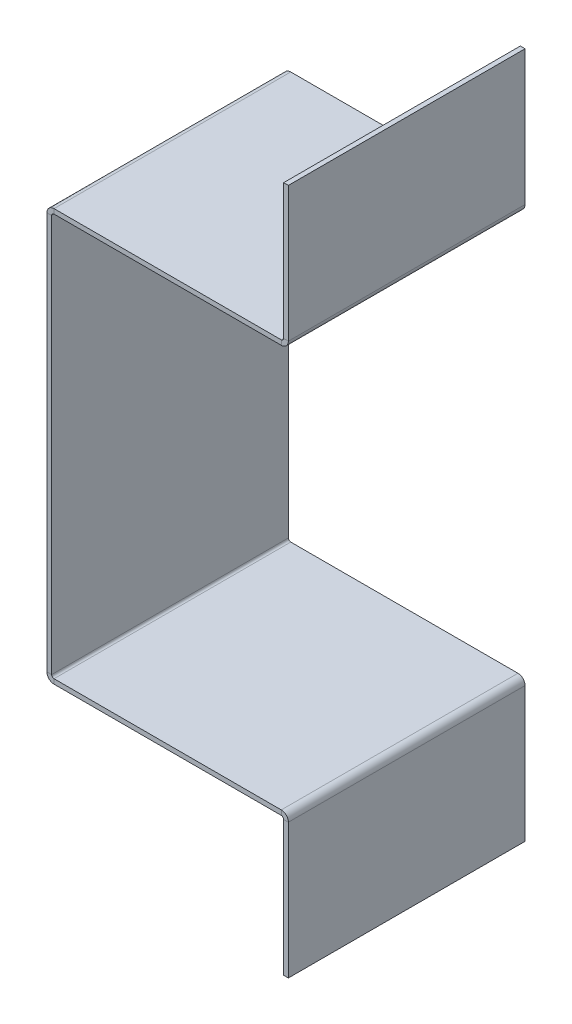
from build123d import *

# Parameters (mm, degrees)
EXTRU_MINCE1_DEPTH        = 100
CONVERTIR_VOLUME1_DEPTH   = 100
CONVERTIR_VOLUME1_2_DEPTH = 100


# Read off the part's stored shape, not the designer's step: Convertir-Volume1
with BuildPart() as part:
    # Esquisse1 → Extru.-Mince1 (new body)
    with BuildSketch(Plane.XY):
        Polygon((-133.505441468, 147.472825463), (-133.505441468, 87.472825463), (-233.505441468, 87.472825463), (-233.505441468, -82.527174537), (-133.505441468, -82.527174537), (-133.505441468, -142.527174537), (-123.505441468, -142.527174537), (-123.505441468, -72.527174537), (-223.505441468, -72.527174537), (-223.505441468, 77.472825463), (-123.505441468, 77.472825463), (-123.505441468, 147.472825463), align=None)
    extrude(amount=EXTRU_MINCE1_DEPTH)

    # Convertir-Volume1 outline → Convertir-Volume1 (cut)
    with BuildSketch(Plane.XY):
        with BuildLine():
            Line((-123.505441468, 147.472825463), (-133.505441468, 147.472825463))
            Line((-133.505441468, 147.472825463), (-133.505441468, 87.472825463))
            Line((-133.505441468, 87.472825463), (-232.505441468, 87.472825463))
            ThreePointArc((-232.505441468, 87.472825463), (-233.212548249, 87.179932244), (-233.505441468, 86.472825463))
            Line((-233.505441468, 86.472825463), (-233.505441468, -81.527174537))
            ThreePointArc((-233.505441468, -81.527174537), (-233.212548249, -82.234281318), (-232.505441468, -82.527174537))
            Line((-232.505441468, -82.527174537), (-133.505441468, -82.527174537))
            Line((-133.505441468, -82.527174537), (-133.505441468, -142.527174537))
            Line((-133.505441468, -142.527174537), (-123.505441468, -142.527174537))
            Line((-123.505441468, -142.527174537), (-123.505441468, -72.527174537))
            Line((-123.505441468, -72.527174537), (-223.505441468, -72.527174537))
            Line((-223.505441468, -72.527174537), (-223.505441468, 77.472825463))
            Line((-223.505441468, 77.472825463), (-123.505441468, 77.472825463))
            Line((-123.505441468, 77.472825463), (-123.505441468, 147.472825463))
        make_face()
    extrude(amount=CONVERTIR_VOLUME1_DEPTH, mode=Mode.SUBTRACT)

    # Convertir-Volume1 2 outline → Convertir-Volume1 2 (add)
    with BuildSketch(Plane.XY):
        with BuildLine():
            Line((-133.505441468, 147.472825463), (-135.505441468, 147.472825463))
            Line((-135.505441468, 147.472825463), (-135.505441468, 90.472825463))
            ThreePointArc((-135.505441468, 90.472825463), (-135.798334686, 89.765718682), (-136.505441468, 89.472825463))
            Line((-136.505441468, 89.472825463), (-232.505441468, 89.472825463))
            ThreePointArc((-232.505441468, 89.472825463), (-234.626761811, 88.594145807), (-235.505441468, 86.472825463))
            Line((-235.505441468, 86.472825463), (-235.505441468, -81.527174537))
            ThreePointArc((-235.505441468, -81.527174537), (-234.626761811, -83.64849488), (-232.505441468, -84.527174537))
            Line((-232.505441468, -84.527174537), (-136.505441468, -84.527174537))
            ThreePointArc((-136.505441468, -84.527174537), (-135.798334686, -84.820067756), (-135.505441468, -85.527174537))
            Line((-135.505441468, -85.527174537), (-135.505441468, -142.527174537))
            Line((-135.505441468, -142.527174537), (-133.505441468, -142.527174537))
            Line((-133.505441468, -142.527174537), (-133.505441468, -85.527174537))
            ThreePointArc((-133.505441468, -85.527174537), (-134.384121124, -83.405854193), (-136.505441468, -82.527174537))
            Line((-136.505441468, -82.527174537), (-233.505441468, -82.527174537))
            Line((-233.505441468, -82.527174537), (-233.505441468, 87.472825463))
            Line((-233.505441468, 87.472825463), (-136.505441468, 87.472825463))
            ThreePointArc((-136.505441468, 87.472825463), (-134.384121124, 88.351505119), (-133.505441468, 90.472825463))
            Line((-133.505441468, 90.472825463), (-133.505441468, 147.472825463))
        make_face()
    extrude(amount=CONVERTIR_VOLUME1_2_DEPTH)


solid = part.part
